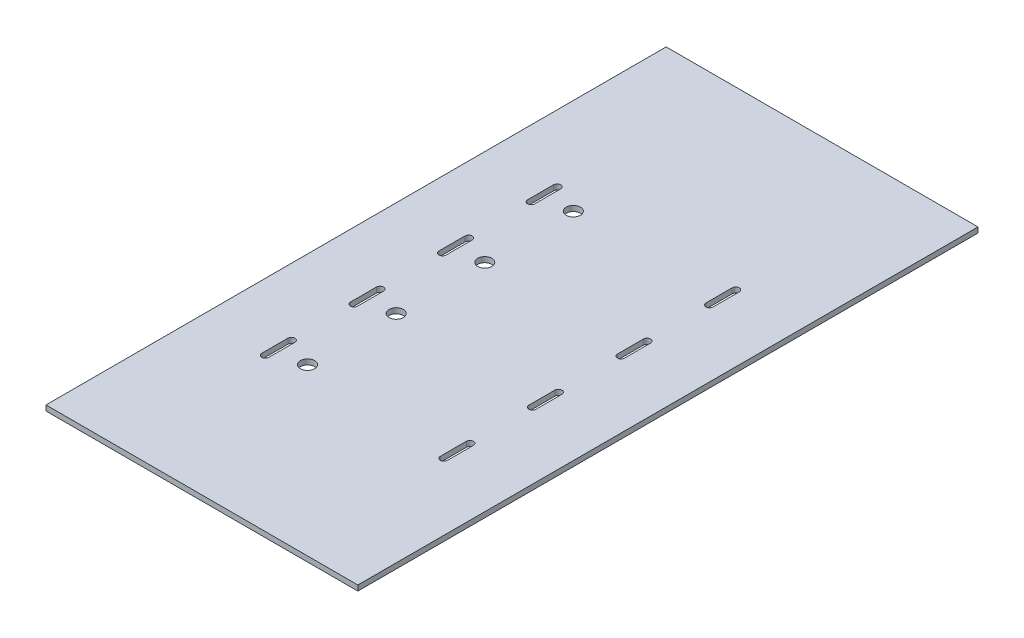
from build123d import *

# Parameters (mm, degrees)
SKETCH1_W                 = 176
SKETCH1_H                 = 350
BOSS_EXTRUDE1_DEPTH       = 3
F_4_0MM_DOWEL_SLOT1_DEPTH = 3
F_8_0MM_DOWEL_HOLE1_D     = 8
CUT_EXTRUDE1_DEPTH        = 0.5


# Read off the part's stored shape, not the designer's step: Ø4.0mm Dowel Slot1
with BuildPart() as part:
    # Sketch1 → Boss-Extrude1 (new body)
    with BuildSketch(Plane(origin=(0, 0, 0), x_dir=(1, 0, 0), z_dir=(0, 1, 0))):
        with Locations((88, 175)):
            Rectangle(SKETCH1_W, SKETCH1_H)
    extrude(amount=BOSS_EXTRUDE1_DEPTH)

    # Ø4.0mm Dowel Slot1 outline → Ø4.0mm Dowel Slot1 (cut)
    with BuildSketch(Plane(origin=(0, 0, 0), x_dir=(1, 0, 0), z_dir=(0, 1, 0))):
        with BuildLine():
            ThreePointArc((39.625, 250.85), (37.625, 252.85), (35.625, 250.85))
            Line((35.625, 250.85), (35.625, 236.15))
            ThreePointArc((35.625, 236.15), (37.625, 234.15), (39.625, 236.15))
            Line((39.625, 236.15), (39.625, 250.85))
        make_face()
        with BuildLine():
            Line((39.625, 186.15), (39.625, 200.85))
            ThreePointArc((39.625, 200.85), (37.625, 202.85), (35.625, 200.85))
            Line((35.625, 200.85), (35.625, 186.15))
            ThreePointArc((35.625, 186.15), (37.625, 184.15), (39.625, 186.15))
        make_face()
        with BuildLine():
            Line((39.625, 136.15), (39.625, 150.85))
            ThreePointArc((39.625, 150.85), (37.625, 152.85), (35.625, 150.85))
            Line((35.625, 150.85), (35.625, 136.15))
            ThreePointArc((35.625, 136.15), (37.625, 134.15), (39.625, 136.15))
        make_face()
        with BuildLine():
            Line((39.625, 86.15), (39.625, 100.85))
            ThreePointArc((39.625, 100.85), (37.625, 102.85), (35.625, 100.85))
            Line((35.625, 100.85), (35.625, 86.15))
            ThreePointArc((35.625, 86.15), (37.625, 84.15), (39.625, 86.15))
        make_face()
        with BuildLine():
            ThreePointArc((140.375, 250.85), (138.375, 252.85), (136.375, 250.85))
            Line((136.375, 250.85), (136.375, 236.15))
            ThreePointArc((136.375, 236.15), (138.375, 234.15), (140.375, 236.15))
            Line((140.375, 236.15), (140.375, 250.85))
        make_face()
        with BuildLine():
            Line((140.375, 186.15), (140.375, 200.85))
            ThreePointArc((140.375, 200.85), (138.375, 202.85), (136.375, 200.85))
            Line((136.375, 200.85), (136.375, 186.15))
            ThreePointArc((136.375, 186.15), (138.375, 184.15), (140.375, 186.15))
        make_face()
        with BuildLine():
            Line((140.375, 136.15), (140.375, 150.85))
            ThreePointArc((140.375, 150.85), (138.375, 152.85), (136.375, 150.85))
            Line((136.375, 150.85), (136.375, 136.15))
            ThreePointArc((136.375, 136.15), (138.375, 134.15), (140.375, 136.15))
        make_face()
        with BuildLine():
            Line((140.375, 86.15), (140.375, 100.85))
            ThreePointArc((140.375, 100.85), (138.375, 102.85), (136.375, 100.85))
            Line((136.375, 100.85), (136.375, 86.15))
            ThreePointArc((136.375, 86.15), (138.375, 84.15), (140.375, 86.15))
        make_face()
    extrude(amount=F_4_0MM_DOWEL_SLOT1_DEPTH, mode=Mode.SUBTRACT)

    # Ø8.0mm Dowel Hole1 (through all)
    with Locations(Plane(origin=(0, 3, 0), x_dir=(1, 0, 0), z_dir=(0, 1, 0))):
        with Locations((54.125, 93.5), (54.125, 143.5), (54.125, 193.5), (54.125, 243.5)):
            Hole(F_8_0MM_DOWEL_HOLE1_D / 2)

    # Sketch14 → Cut-Extrude1 (cut)
    # profile 1 of 13: a face of its own
    with BuildSketch(Plane.XZ):
        with BuildLine():
            add(Edge.make_bspline(
                [(140.85382816, -299.8668019), (140.92258671, -299.78523615), (141.58308592, -299.01837544), (142.32160419, -298.16266478)],
                knots=[0, 0, 0, 0, 1, 1, 1, 1], degree=3))
            Line((142.32160419, -298.16266478), (143.66436456, -296.60682777))
            Line((143.66436456, -296.60682777), (150.40594808, -296.60640175))
            Line((150.40594808, -296.60640175), (157.14753146, -296.6059758))
            Line((157.14753146, -296.6059758), (157.71891472, -297.93057096))
            add(Edge.make_bspline(
                [(157.71891472, -297.93057096), (158.03317566, -298.65910646), (158.29459409, -299.27160898), (158.29984451, -299.29168743)],
                knots=[0, 0, 0, 0, 1, 1, 1, 1], degree=3))
            add(Edge.make_bspline(
                [(158.29984451, -299.29168743), (158.30933056, -299.32796227), (158.26469534, -299.32822344), (151.27505338, -299.33284813)],
                knots=[0, 0, 0, 0, 1, 1, 1, 1], degree=3))
            Line((151.27505338, -299.33284813), (144.24071628, -299.33750236))
            Line((144.24071628, -299.33750236), (143.66198099, -300.00425236))
            Line((143.66198099, -300.00425236), (143.08324563, -300.67100236))
            Line((143.08324563, -300.67100236), (143.08252337, -302.03228403))
            Line((143.08252337, -302.03228403), (143.08180104, -303.39356528))
            Line((143.08180104, -303.39356528), (143.66942451, -304.07396717))
            Line((143.66942451, -304.07396717), (144.25703125, -304.75436906))
            Line((144.25703125, -304.75436906), (149.82469265, -304.75460797))
            Line((149.82469265, -304.75460797), (155.39235279, -304.75484688))
            Line((155.39235279, -304.75484688), (156.85797856, -306.45200717))
            Line((156.85797856, -306.45200717), (158.32360433, -308.14916739))
            Line((158.32360433, -308.14916739), (158.32360433, -310.17946335))
            Line((158.32360433, -310.17946335), (158.32360433, -312.20975917))
            Line((158.32360433, -312.20975917), (156.8568475, -313.90893231))
            Line((156.8568475, -313.90893231), (155.39009046, -315.60810538))
            Line((155.39009046, -315.60810538), (148.64782521, -315.60345017))
            Line((148.64782521, -315.60345017), (141.90555772, -315.59879482))
            Line((141.90555772, -315.59879482), (141.32644646, -314.25760497))
            add(Edge.make_bspline(
                [(141.32644646, -314.25760497), (141.00793442, -313.5199505), (140.74733331, -312.90945754), (140.74733331, -312.90095387)],
                knots=[0, 0, 0, 0, 1, 1, 1, 1], degree=3))
            add(Edge.make_bspline(
                [(140.74733331, -312.90095387), (140.74733331, -312.89245027), (143.91231226, -312.88517524), (147.78062055, -312.88478709)],
                knots=[0, 0, 0, 0, 1, 1, 1, 1], degree=3))
            Line((147.78062055, -312.88478709), (154.81390646, -312.88408142))
            Line((154.81390646, -312.88408142), (155.39228314, -312.21340666))
            Line((155.39228314, -312.21340666), (155.9706601, -311.54273211))
            Line((155.9706601, -311.54273211), (155.97106015, -310.18138828))
            Line((155.97106015, -310.18138828), (155.9714602, -308.82004459))
            Line((155.9714602, -308.82004459), (155.38456571, -308.13946637))
            Line((155.38456571, -308.13946637), (154.79767129, -307.45888836))
            Line((154.79767129, -307.45888836), (149.23001465, -307.45888836))
            Line((149.23001465, -307.45888836), (143.66235878, -307.45888836))
            Line((143.66235878, -307.45888836), (142.19558473, -305.75966706))
            Line((142.19558473, -305.75966706), (140.7288125, -304.06044583))
            Line((140.7288125, -304.06044583), (140.7288125, -302.03777392))
            Line((140.7288125, -302.03777392), (140.7288125, -300.01510187))
            Line((140.7288125, -300.01510187), (140.85382816, -299.8668019))
        make_face()
    # profile 2 of 13: a face of its own
    with BuildSketch(Plane.XZ):
        with BuildLine():
            add(Edge.make_bspline(
                [(124.36064824, -299.29540268), (124.36537107, -299.27734114), (124.62679258, -298.66493872), (124.94158377, -297.93451035)],
                knots=[0, 0, 0, 0, 1, 1, 1, 1], degree=3))
            Line((124.94158377, -297.93451035), (125.5139331, -296.60645922))
            Line((125.5139331, -296.60645922), (130.49617246, -296.60607023))
            Line((130.49617246, -296.60607023), (135.47841371, -296.60568131))
            Line((135.47841371, -296.60568131), (136.94596378, -298.30496589))
            Line((136.94596378, -298.30496589), (138.41349908, -300.00425236))
            Line((138.41349908, -300.00425236), (138.41368423, -304.0712672))
            Line((138.41368423, -304.0712672), (138.41386945, -308.13828162))
            Line((138.41386945, -308.13828162), (136.94781213, -309.83587654))
            Line((136.94781213, -309.83587654), (135.48175488, -311.53347153))
            Line((135.48175488, -311.53347153), (130.79037224, -311.53347153))
            Line((130.79037224, -311.53347153), (126.09898953, -311.53347153))
            Line((126.09898953, -311.53347153), (124.63510662, -309.83803275))
            Line((124.63510662, -309.83803275), (123.17122364, -308.14259397))
            Line((123.17122364, -308.14259397), (123.17122364, -307.12566113))
            Line((123.17122364, -307.12566113), (123.17122364, -306.10872815))
            Line((123.17122364, -306.10872815), (124.63508065, -304.4131416))
            Line((124.63508065, -304.4131416), (126.0987747, -302.71755484))
            Line((126.0987747, -302.71755484), (130.49676326, -302.71755484))
            Line((130.49676326, -302.71755484), (134.89475, -302.71755484))
            Line((134.89475, -302.71755484), (134.89475, -304.06957565))
            Line((134.89475, -304.06957565), (134.89475, -305.42159653))
            Line((134.89475, -305.42159653), (130.7947968, -305.42159653))
            Line((130.7947968, -305.42159653), (126.69484367, -305.42159653))
            Line((126.69484367, -305.42159653), (126.10902599, -306.10021188))
            Line((126.10902599, -306.10021188), (125.52320831, -306.77882723))
            Line((125.52320831, -306.77882723), (125.52320831, -307.12532702))
            Line((125.52320831, -307.12532702), (125.52320831, -307.47182681))
            Line((125.52320831, -307.47182681), (126.10836295, -308.15062836))
            Line((126.10836295, -308.15062836), (126.6935157, -308.82942984))
            Line((126.6935157, -308.82942984), (130.79023889, -308.82942984))
            Line((130.79023889, -308.82942984), (134.88696383, -308.82942984))
            Line((134.88696383, -308.82942984), (135.47415575, -308.14878918))
            Line((135.47415575, -308.14878918), (136.06134578, -307.46814859))
            Line((136.06134578, -307.46814859), (136.0608828, -304.06957565))
            Line((136.0608828, -304.06957565), (136.06041975, -300.67100236))
            Line((136.06041975, -300.67100236), (135.48220862, -300.00043708))
            Line((135.48220862, -300.00043708), (134.9039956, -299.3298718))
            Line((134.9039956, -299.3298718), (129.62802882, -299.32905686))
            add(Edge.make_bspline(
                [(129.62802882, -299.32905686), (124.58644682, -299.32827902), (124.35244165, -299.32678256), (124.36064824, -299.29540268)],
                knots=[0, 0, 0, 0, 1, 1, 1, 1], degree=3))
        make_face()
    # profile 3 of 13: a face of its own
    with BuildSketch(Plane.XZ):
        with BuildLine():
            add(Edge.make_bspline(
                [(105.5947898, -299.30509089), (105.5947898, -299.29235782), (105.85446488, -298.67978131), (106.17203605, -297.94380964)],
                knots=[0, 0, 0, 0, 1, 1, 1, 1], degree=3))
            Line((106.17203605, -297.94380964), (106.74943413, -296.60567949))
            Line((106.74943413, -296.60567949), (112.31661141, -296.60567949))
            Line((112.31661141, -296.60567949), (117.88378869, -296.60567949))
            Line((117.88378869, -296.60567949), (119.35117209, -298.30496589))
            Line((119.35117209, -298.30496589), (120.81870739, -300.00425236))
            Line((120.81870739, -300.00425236), (120.81889261, -304.0712672))
            Line((120.81889261, -304.0712672), (120.81907783, -308.13828162))
            Line((120.81907783, -308.13828162), (119.35302051, -309.83587654))
            Line((119.35302051, -309.83587654), (117.88696319, -311.53347153))
            Line((117.88696319, -311.53347153), (112.31746709, -311.53347153))
            Line((112.31746709, -311.53347153), (106.74797281, -311.53347153))
            Line((106.74797281, -311.53347153), (106.45430097, -310.85283087))
            add(Edge.make_bspline(
                [(106.45430097, -310.85283087), (106.29278262, -310.4784785), (106.03087769, -309.87215278), (105.87229115, -309.50544028)],
                knots=[0, 0, 0, 0, 1, 1, 1, 1], degree=3))
            Line((105.87229115, -309.50544028), (105.58395513, -308.83869028))
            Line((105.58395513, -308.83869028), (111.44202252, -308.82942984))
            Line((111.44202252, -308.82942984), (117.30008984, -308.8201694))
            Line((117.30008984, -308.8201694), (117.88342385, -308.14415903))
            Line((117.88342385, -308.14415903), (118.46675786, -307.46814859))
            Line((118.46675786, -307.46814859), (118.46627633, -304.06957565))
            Line((118.46627633, -304.06957565), (118.4657948, -300.67100236))
            Line((118.4657948, -300.67100236), (117.88758367, -300.00043708))
            Line((117.88758367, -300.00043708), (117.30937065, -299.3298718))
            Line((117.30937065, -299.3298718), (111.45215712, -299.32905686))
            add(Edge.make_bspline(
                [(111.45215712, -299.32905686), (106.77925266, -299.32840866), (105.59491209, -299.32356172), (105.5947898, -299.30509089)],
                knots=[0, 0, 0, 0, 1, 1, 1, 1], degree=3))
        make_face()
    # profile 4 of 13: a face of its own
    with BuildSketch(Plane.XZ):
        Polygon((100.30807354, -296.60567949), (101.77536062, -298.30478074), (103.24264581, -300.00386715), (103.24264581, -305.7686699), (103.24264581, -311.53347153), (102.06657294, -311.53347153), (100.8905, -311.53347153), (100.8905, -306.10687126), (100.8905, -300.68027022), (100.3054232, -300.00421533), (99.72034451, -299.32816044), (95.61539072, -299.3328314), (91.51043504, -299.33750236), (90.93214243, -300.00425236), (90.35384975, -300.67100236), (90.35299778, -306.10223712), (90.35214581, -311.53347153), (89.17607294, -311.53347153), (88, -311.53347153), (88, -305.76673594), (88, -300), (89.46562577, -298.30283971), (90.93125154, -296.60567949), (95.61966345, -296.60567949), align=None)
    # profile 5 of 13: a face of its own
    with BuildSketch(Plane.XZ):
        Polygon((85.66620091, -296.60567949), (85.666375, -302.37198073), (85.666375, -308.13828162), (84.20027883, -309.83592043), (82.73418259, -311.53355945), (78.92090599, -311.52888541), (75.10762939, -311.52421109), (74.52775135, -310.18145065), (73.94787149, -308.83869028), (78.04763016, -308.82942984), (82.14738701, -308.8201694), (82.73072109, -308.14415903), (83.3140551, -307.46814859), (83.3140551, -302.03691418), (83.3140551, -296.60567949), (84.49012797, -296.60567949), align=None)
    # profile 6 of 13: a face of its own
    with BuildSketch(Plane.XZ):
        with BuildLine():
            add(Edge.make_bspline(
                [(54.13928647, -299.86680554), (54.20804509, -299.7852435), (54.8685443, -299.01836249), (55.6070625, -298.16262964)],
                knots=[0, 0, 0, 0, 1, 1, 1, 1], degree=3))
            Line((55.6070625, -298.16262964), (56.94982294, -296.60675))
            Line((56.94982294, -296.60675), (64.27944272, -296.60621289))
            Line((64.27944272, -296.60621289), (71.6090625, -296.60567578))
            Line((71.6090625, -296.60567578), (71.6090625, -306.10686734))
            Line((71.6090625, -306.10686734), (71.6090625, -315.60805484))
            Line((71.6090625, -315.60805484), (64.45539066, -315.60755665))
            Line((64.45539066, -315.60755665), (57.30171875, -315.60705839))
            Line((57.30171875, -315.60705839), (55.95895831, -314.05121417))
            add(Edge.make_bspline(
                [(55.95895831, -314.05121417), (55.22044011, -313.1954998), (54.5599409, -312.4286043), (54.49118228, -312.34700208)],
                knots=[0, 0, 0, 0, 1, 1, 1, 1], degree=3))
            Line((54.49118228, -312.34700208), (54.36616669, -312.19863428))
            Line((54.36616669, -312.19863428), (54.36616669, -310.17570995))
            Line((54.36616669, -310.17570995), (54.36616669, -308.15278562))
            Line((54.36616669, -308.15278562), (55.15330206, -307.24163475))
            add(Edge.make_bspline(
                [(55.15330206, -307.24163475), (55.58622658, -306.74050188), (55.9404375, -306.32155062), (55.9404375, -306.31063244)],
                knots=[0, 0, 0, 0, 1, 1, 1, 1], degree=3))
            add(Edge.make_bspline(
                [(55.9404375, -306.31063244), (55.9404375, -306.29971405), (55.50705, -305.78906391), (54.97735419, -305.17585432)],
                knots=[0, 0, 0, 0, 1, 1, 1, 1], degree=3))
            Line((54.97735419, -305.17585432), (54.01427081, -304.06092771))
            Line((54.01427081, -304.06092771), (54.01427081, -302.03801584))
            Line((54.01427081, -302.03801584), (54.01427081, -300.01510376))
            Line((54.01427081, -300.01510376), (54.13928647, -299.86680554))
        make_face()
        Polygon((57.53969663, -299.32824199), (56.95305666, -300.00736386), (56.36641669, -300.6864858), (56.36641669, -302.0415444), (56.36641669, -303.39660307), (56.95305666, -304.0757248), (57.53969663, -304.75484653), (62.81490041, -304.75484653), (68.09010419, -304.75484653), (68.09010419, -306.11612778), (68.09010419, -307.47740903), (62.9907983, -307.47740903), (57.89149059, -307.47740903), (57.30490249, -308.15455032), (56.7183125, -308.83169161), (56.7183125, -310.18145065), (56.7183125, -311.53120976), (57.30490249, -312.20835105), (57.89149059, -312.88549234), (63.57420455, -312.88549234), (69.25691669, -312.88549234), (69.25691669, -306.10686734), (69.25691669, -299.32824199), (63.39830666, -299.32824199), align=None, mode=Mode.SUBTRACT)
    # profile 7 of 13: a face of its own
    with BuildSketch(Plane.XZ):
        with BuildLine():
            add(Edge.make_bspline(
                [(36.47504169, -313.63588835), (36.47504169, -313.40051279), (36.61892445, -313.13701578), (36.81400444, -313.01513962)],
                knots=[0, 0, 0, 0, 1, 1, 1, 1], degree=3))
            Line((36.81400444, -313.01513962), (36.9177618, -312.95031675))
            Line((36.9177618, -312.95031675), (36.9186508, -312.20859976))
            Line((36.9186508, -312.20859976), (36.9195398, -311.46688284))
            Line((36.9195398, -311.46688284), (34.34557554, -307.75897255))
            Line((34.34557554, -307.75897255), (31.77160939, -304.05106226))
            Line((31.77160939, -304.05106226), (34.35946613, -300.32007332))
            Line((34.35946613, -300.32007332), (36.94732105, -296.58908662))
            Line((36.94732105, -296.58908662), (42.13315443, -296.58908662))
            Line((42.13315443, -296.58908662), (47.31898774, -296.58908662))
            Line((47.31898774, -296.58908662), (49.90682782, -300.32004742))
            Line((49.90682782, -300.32004742), (52.49466797, -304.05105134))
            Line((52.49466797, -304.05105134), (49.90682782, -307.78202747))
            Line((49.90682782, -307.78202747), (47.31898956, -311.51300374))
            Line((47.31898956, -311.51300374), (42.41559897, -311.51397793))
            Line((42.41559897, -311.51397793), (37.51220831, -311.51495212))
            Line((37.51220831, -311.51495212), (37.51220831, -312.2244584))
            Line((37.51220831, -312.2244584), (37.51220831, -312.93396468))
            Line((37.51220831, -312.93396468), (37.62622627, -313.00696362))
            add(Edge.make_bspline(
                [(37.62622627, -313.00696362), (37.83257619, -313.13907735), (37.97522919, -313.3960239), (37.97522919, -313.63558756)],
                knots=[0, 0, 0, 0, 1, 1, 1, 1], degree=3))
            add(Edge.make_bspline(
                [(37.97522919, -313.63558756), (37.97522919, -314.12407045), (37.48259726, -314.4928056), (37.0183651, -314.3517997)],
                knots=[0, 0, 0, 0, 1, 1, 1, 1], degree=3))
            add(Edge.make_bspline(
                [(37.0183651, -314.3517997), (36.70211637, -314.25574171), (36.47504169, -313.95653749), (36.47504169, -313.63588835)],
                knots=[0, 0, 0, 0, 1, 1, 1, 1], degree=3))
        make_face()
        with BuildLine():
            add(Edge.make_bspline(
                [(50.22886254, -304.04120192), (50.22288398, -304.02511144), (47.01417183, -299.39579297), (46.5096329, -298.67534184)],
                knots=[0, 0, 0, 0, 1, 1, 1, 1], degree=3))
            Line((46.5096329, -298.67534184), (46.34423445, -298.43916233))
            Line((46.34423445, -298.43916233), (42.12897053, -298.4438314))
            Line((42.12897053, -298.4438314), (37.9137085, -298.44850236))
            Line((37.9137085, -298.44850236), (35.97211402, -301.24514824))
            add(Edge.make_bspline(
                [(35.97211402, -301.24514824), (34.90423609, -302.78330381), (34.03052689, -304.04596164), (34.03053802, -304.05105484)],
                knots=[0, 0, 0, 0, 1, 1, 1, 1], degree=3))
            add(Edge.make_bspline(
                [(34.03053802, -304.05105484), (34.03054726, -304.05614804), (34.90427312, -305.31880587), (35.97214734, -306.85696109)],
                knots=[0, 0, 0, 0, 1, 1, 1, 1], degree=3))
            Line((35.97214734, -306.85696109), (37.91374, -309.6536069))
            Line((37.91374, -309.6536069), (42.13315625, -309.6536069))
            Line((42.13315625, -309.6536069), (46.3525725, -309.6536069))
            Line((46.3525725, -309.6536069), (48.2942689, -306.85696109))
            add(Edge.make_bspline(
                [(48.2942689, -306.85696109), (49.36220234, -305.31880587), (50.23276861, -304.05171417), (50.22886254, -304.04120192)],
                knots=[0, 0, 0, 0, 1, 1, 1, 1], degree=3))
        make_face(mode=Mode.SUBTRACT)
    # profile 8 of 13: a face of its own
    with BuildSketch(Plane.XZ):
        with BuildLine():
            add(Edge.make_bspline(
                [(45.328, -302.30147785), (45.4451443, -302.29770107), (45.56599272, -302.29857005), (45.59655206, -302.30340922)],
                knots=[0, 0, 0, 0, 1, 1, 1, 1], degree=3))
            add(Edge.make_bspline(
                [(45.59655206, -302.30340922), (46.00304178, -302.36777758), (46.31681062, -302.52078302), (46.59362114, -302.78961571)],
                knots=[0, 0, 0, 0, 1, 1, 1, 1], degree=3))
            add(Edge.make_bspline(
                [(46.59362114, -302.78961571), (46.832188, -303.02130836), (46.99304142, -303.29984592), (47.07286809, -303.61949441)],
                knots=[0, 0, 0, 0, 1, 1, 1, 1], degree=3))
            add(Edge.make_bspline(
                [(47.07286809, -303.61949441), (47.10473874, -303.74711351), (47.11357687, -303.8367847), (47.11357687, -304.03253403)],
                knots=[0, 0, 0, 0, 1, 1, 1, 1], degree=3))
            add(Edge.make_bspline(
                [(47.11357687, -304.03253403), (47.11357687, -304.40403285), (47.03371877, -304.68043835), (46.8376998, -304.98740739)],
                knots=[0, 0, 0, 0, 1, 1, 1, 1], degree=3))
            add(Edge.make_bspline(
                [(46.8376998, -304.98740739), (46.74240453, -305.13664123), (46.51250731, -305.36976559), (46.36160698, -305.47018297)],
                knots=[0, 0, 0, 0, 1, 1, 1, 1], degree=3))
            add(Edge.make_bspline(
                [(46.36160698, -305.47018297), (46.0506996, -305.67707938), (45.76478236, -305.76254784), (45.3835625, -305.76254784)],
                knots=[0, 0, 0, 0, 1, 1, 1, 1], degree=3))
            add(Edge.make_bspline(
                [(45.3835625, -305.76254784), (45.01206424, -305.76254784), (44.73565748, -305.68269023), (44.42868949, -305.48667077)],
                knots=[0, 0, 0, 0, 1, 1, 1, 1], degree=3))
            add(Edge.make_bspline(
                [(44.42868949, -305.48667077), (44.279456, -305.39137529), (44.04633059, -305.16147863), (43.94591433, -305.01057921)],
                knots=[0, 0, 0, 0, 1, 1, 1, 1], degree=3))
            add(Edge.make_bspline(
                [(43.94591433, -305.01057921), (43.73901806, -304.69967092), (43.65354813, -304.41375389), (43.65354813, -304.03253403)],
                knots=[0, 0, 0, 0, 1, 1, 1, 1], degree=3))
            add(Edge.make_bspline(
                [(43.65354813, -304.03253403), (43.65354813, -303.8367847), (43.66238626, -303.74711351), (43.69425691, -303.61949441)],
                knots=[0, 0, 0, 0, 1, 1, 1, 1], degree=3))
            add(Edge.make_bspline(
                [(43.69425691, -303.61949441), (43.77408358, -303.29984592), (43.934937, -303.02130836), (44.17350386, -302.78961571)],
                knots=[0, 0, 0, 0, 1, 1, 1, 1], degree=3))
            add(Edge.make_bspline(
                [(44.17350386, -302.78961571), (44.49972423, -302.47279704), (44.86998538, -302.31624484), (45.328, -302.30147785)],
                knots=[0, 0, 0, 0, 1, 1, 1, 1], degree=3))
        make_face()
    # profile 9 of 13: a face of its own
    with BuildSketch(Plane.XZ):
        with BuildLine():
            add(Edge.make_bspline(
                [(38.84570831, -302.30147785), (38.96285261, -302.29770107), (39.08370103, -302.29857005), (39.11426044, -302.30340922)],
                knots=[0, 0, 0, 0, 1, 1, 1, 1], degree=3))
            add(Edge.make_bspline(
                [(39.11426044, -302.30340922), (39.52075009, -302.36777758), (39.83451893, -302.52078302), (40.11132945, -302.78961571)],
                knots=[0, 0, 0, 0, 1, 1, 1, 1], degree=3))
            add(Edge.make_bspline(
                [(40.11132945, -302.78961571), (40.34989631, -303.02130836), (40.5107498, -303.29984592), (40.5905764, -303.61949441)],
                knots=[0, 0, 0, 0, 1, 1, 1, 1], degree=3))
            add(Edge.make_bspline(
                [(40.5905764, -303.61949441), (40.62244705, -303.74711351), (40.63128518, -303.8367847), (40.63128518, -304.03253403)],
                knots=[0, 0, 0, 0, 1, 1, 1, 1], degree=3))
            add(Edge.make_bspline(
                [(40.63128518, -304.03253403), (40.63128518, -304.40403285), (40.55142708, -304.68043835), (40.35540811, -304.98740739)],
                knots=[0, 0, 0, 0, 1, 1, 1, 1], degree=3))
            add(Edge.make_bspline(
                [(40.35540811, -304.98740739), (40.26011291, -305.13664123), (40.03021562, -305.36976559), (39.87931529, -305.47018297)],
                knots=[0, 0, 0, 0, 1, 1, 1, 1], degree=3))
            add(Edge.make_bspline(
                [(39.87931529, -305.47018297), (39.56840791, -305.67707938), (39.28249074, -305.76254784), (38.90127081, -305.76254784)],
                knots=[0, 0, 0, 0, 1, 1, 1, 1], degree=3))
            add(Edge.make_bspline(
                [(38.90127081, -305.76254784), (38.51946015, -305.76254784), (38.23454678, -305.67723086), (37.92160583, -305.4691882)],
                knots=[0, 0, 0, 0, 1, 1, 1, 1], degree=3))
            add(Edge.make_bspline(
                [(37.92160583, -305.4691882), (37.77444854, -305.3713576), (37.5400618, -305.13248225), (37.44422389, -304.98266272)],
                knots=[0, 0, 0, 0, 1, 1, 1, 1], degree=3))
            add(Edge.make_bspline(
                [(37.44422389, -304.98266272), (37.25146461, -304.68133197), (37.17125644, -304.40215041), (37.17125644, -304.03253403)],
                knots=[0, 0, 0, 0, 1, 1, 1, 1], degree=3))
            add(Edge.make_bspline(
                [(37.17125644, -304.03253403), (37.17125644, -303.8367847), (37.18009464, -303.74711351), (37.21196529, -303.61949441)],
                knots=[0, 0, 0, 0, 1, 1, 1, 1], degree=3))
            add(Edge.make_bspline(
                [(37.21196529, -303.61949441), (37.29179189, -303.29984592), (37.45264531, -303.02130836), (37.69121217, -302.78961571)],
                knots=[0, 0, 0, 0, 1, 1, 1, 1], degree=3))
            add(Edge.make_bspline(
                [(37.69121217, -302.78961571), (38.01743261, -302.47279704), (38.38769369, -302.31624484), (38.84570831, -302.30147785)],
                knots=[0, 0, 0, 0, 1, 1, 1, 1], degree=3))
        make_face()
    # profile 10 of 13: a face of its own
    with BuildSketch(Plane.XZ):
        with BuildLine():
            add(Edge.make_bspline(
                [(18.51508583, -299.30509096), (18.5311138, -299.2648285), (19.63487583, -296.70994617), (19.65928259, -296.65661177)],
                knots=[0, 0, 0, 0, 1, 1, 1, 1], degree=3))
            Line((19.65928259, -296.65661177), (19.68259105, -296.60567949))
            Line((19.68259105, -296.60567949), (22.31838897, -296.60567949))
            Line((22.31838897, -296.60567949), (24.95418696, -296.60567949))
            Line((24.95418696, -296.60567949), (26.41778098, -298.30051725))
            Line((26.41778098, -298.30051725), (27.881375, -299.99535683))
            Line((27.881375, -299.99535683), (27.881375, -304.41239316))
            Line((27.881375, -304.41239316), (27.881375, -308.82942984))
            Line((27.881375, -308.82942984), (29.05744794, -308.82942984))
            Line((29.05744794, -308.82942984), (30.23352081, -308.82942984))
            Line((30.23352081, -308.82942984), (30.23352081, -310.18145065))
            Line((30.23352081, -310.18145065), (30.23352081, -311.53347153))
            Line((30.23352081, -311.53347153), (29.05756645, -311.53347153))
            Line((29.05756645, -311.53347153), (27.88161391, -311.53347153))
            Line((27.88161391, -311.53347153), (27.87686336, -312.8960083))
            Line((27.87686336, -312.8960083), (27.87211456, -314.25854507))
            Line((27.87211456, -314.25854507), (26.7145625, -314.92924034))
            Line((26.7145625, -314.92924034), (25.55701044, -315.59993568))
            Line((25.55701044, -315.59993568), (25.54775, -313.57133379))
            Line((25.54775, -313.57133379), (25.53848956, -311.5427319))
            Line((25.53848956, -311.5427319), (22.02416147, -311.53805394))
            Line((22.02416147, -311.53805394), (18.50983331, -311.53337577))
            Line((18.50983331, -311.53337577), (18.50983331, -310.18145065))
            Line((18.50983331, -310.18145065), (18.50983331, -308.8295256))
            Line((18.50983331, -308.8295256), (22.02416147, -308.82484743))
            Line((22.02416147, -308.82484743), (25.53848956, -308.8201694))
            Line((25.53848956, -308.8201694), (25.54316052, -304.75389859))
            Line((25.54316052, -304.75389859), (25.54783337, -300.68762666))
            Line((25.54783337, -300.68762666), (24.96160269, -300.00793436))
            Line((24.96160269, -300.00793436), (24.37537201, -299.32824199))
            Line((24.37537201, -299.32824199), (21.44062187, -299.32824199))
            add(Edge.make_bspline(
                [(21.44062187, -299.32824199), (19.10025342, -299.32824199), (18.50773681, -299.32355248), (18.51508583, -299.30509096)],
                knots=[0, 0, 0, 0, 1, 1, 1, 1], degree=3))
        make_face()
    # profile 11 of 13: a face of its own
    with BuildSketch(Plane.XZ):
        with BuildLine():
            add(Edge.make_bspline(
                [(40.01777522, -316.33036734), (40.02042927, -316.33036734), (40.09289943, -316.40103521), (40.1788231, -316.48740716)],
                knots=[0, 0, 0, 0, 1, 1, 1, 1], degree=3))
            Line((40.1788231, -316.48740716), (40.33504637, -316.64444698))
            Line((40.33504637, -316.64444698), (40.28027837, -316.70239312))
            add(Edge.make_bspline(
                [(40.28027837, -316.70239312), (40.25015611, -316.73426335), (40.14633386, -316.82691087), (40.0495625, -316.90827621)],
                knots=[0, 0, 0, 0, 1, 1, 1, 1], degree=3))
            add(Edge.make_bspline(
                [(40.0495625, -316.90827621), (39.26923904, -317.56437326), (38.23823053, -317.9415537), (37.22513544, -317.9415537)],
                knots=[0, 0, 0, 0, 1, 1, 1, 1], degree=3))
            add(Edge.make_bspline(
                [(37.22513544, -317.9415537), (36.21229585, -317.9415537), (35.18353952, -317.56531966), (34.40070831, -316.90861291)],
                knots=[0, 0, 0, 0, 1, 1, 1, 1], degree=3))
            add(Edge.make_bspline(
                [(34.40070831, -316.90861291), (34.30393702, -316.82743279), (34.20859359, -316.74297394), (34.18883553, -316.72092688)],
                knots=[0, 0, 0, 0, 1, 1, 1, 1], degree=3))
            Line((34.18883553, -316.72092688), (34.15290887, -316.68084117))
            Line((34.15290887, -316.68084117), (34.30881168, -316.5241251))
            add(Edge.make_bspline(
                [(34.30881168, -316.5241251), (34.39455755, -316.43793116), (34.46906506, -316.36770499), (34.47438233, -316.36806647)],
                knots=[0, 0, 0, 0, 1, 1, 1, 1], degree=3))
            add(Edge.make_bspline(
                [(34.47438233, -316.36806647), (34.47970156, -316.36842767), (34.57025174, -316.44309177), (34.67560566, -316.53398558)],
                knots=[0, 0, 0, 0, 1, 1, 1, 1], degree=3))
            add(Edge.make_bspline(
                [(34.67560566, -316.53398558), (35.58678992, -317.32010455), (36.80120648, -317.63772311), (37.99375, -317.40181401)],
                knots=[0, 0, 0, 0, 1, 1, 1, 1], degree=3))
            add(Edge.make_bspline(
                [(37.99375, -317.40181401), (38.67031792, -317.26797492), (39.26087502, -316.97750565), (39.80055913, -316.51312481)],
                knots=[0, 0, 0, 0, 1, 1, 1, 1], degree=3))
            add(Edge.make_bspline(
                [(39.80055913, -316.51312481), (39.91737562, -316.41260817), (40.01512299, -316.33036734), (40.01777522, -316.33036734)],
                knots=[0, 0, 0, 0, 1, 1, 1, 1], degree=3))
        make_face()
    # profile 12 of 13: a face of its own
    with BuildSketch(Plane.XZ):
        with BuildLine():
            add(Edge.make_bspline(
                [(37.7715, -316.25860019), (38.26704526, -316.15220061), (38.66837507, -315.95357673), (39.04200693, -315.62981014)],
                knots=[0, 0, 0, 0, 1, 1, 1, 1], degree=3))
            Line((39.04200693, -315.62981014), (39.19200531, -315.4998319))
            Line((39.19200531, -315.4998319), (39.35365148, -315.66223015))
            Line((39.35365148, -315.66223015), (39.51529576, -315.82462854))
            Line((39.51529576, -315.82462854), (39.39812185, -315.93093964))
            add(Edge.make_bspline(
                [(39.39812185, -315.93093964), (38.87938293, -316.4015859), (38.26499503, -316.67712438), (37.55851044, -316.75596237)],
                knots=[0, 0, 0, 0, 1, 1, 1, 1], degree=3))
            add(Edge.make_bspline(
                [(37.55851044, -316.75596237), (36.72878819, -316.84855284), (35.85968331, -316.58415276), (35.18979213, -316.03534786)],
                knots=[0, 0, 0, 0, 1, 1, 1, 1], degree=3))
            add(Edge.make_bspline(
                [(35.18979213, -316.03534786), (35.11741458, -315.97605324), (35.04197369, -315.90944453), (35.02214339, -315.88732845)],
                knots=[0, 0, 0, 0, 1, 1, 1, 1], degree=3))
            Line((35.02214339, -315.88732845), (34.98608709, -315.84711709))
            Line((34.98608709, -315.84711709), (35.14623855, -315.68696654))
            Line((35.14623855, -315.68696654), (35.30638819, -315.52681578))
            Line((35.30638819, -315.52681578), (35.41538519, -315.62161748))
            add(Edge.make_bspline(
                [(35.41538519, -315.62161748), (35.68902303, -315.85962112), (36.04449528, -316.06549924), (36.36391669, -316.1709765)],
                knots=[0, 0, 0, 0, 1, 1, 1, 1], degree=3))
            add(Edge.make_bspline(
                [(36.36391669, -316.1709765), (36.66595815, -316.27071467), (36.86538304, -316.30035505), (37.23439581, -316.30035505)],
                knots=[0, 0, 0, 0, 1, 1, 1, 1], degree=3))
            add(Edge.make_bspline(
                [(37.23439581, -316.30035505), (37.52007043, -316.30035505), (37.60936124, -316.29341364), (37.7715, -316.25860019)],
                knots=[0, 0, 0, 0, 1, 1, 1, 1], degree=3))
        make_face()
    # profile 13 of 13: a face of its own
    with BuildSketch(Plane.XZ):
        with BuildLine():
            add(Edge.make_bspline(
                [(38.2933115, -314.60792984), (38.29705461, -314.60792984), (38.37293447, -314.68108712), (38.46193443, -314.77050148)],
                knots=[0, 0, 0, 0, 1, 1, 1, 1], degree=3))
            Line((38.46193443, -314.77050148), (38.6237528, -314.93307305))
            Line((38.6237528, -314.93307305), (38.51711172, -315.0232775))
            add(Edge.make_bspline(
                [(38.51711172, -315.0232775), (38.29163724, -315.21399579), (38.01401367, -315.3578054), (37.71974907, -315.43631096)],
                knots=[0, 0, 0, 0, 1, 1, 1, 1], degree=3))
            add(Edge.make_bspline(
                [(37.71974907, -315.43631096), (37.56191643, -315.47841862), (37.50384436, -315.48426824), (37.24365625, -315.48426824)],
                knots=[0, 0, 0, 0, 1, 1, 1, 1], degree=3))
            add(Edge.make_bspline(
                [(37.24365625, -315.48426824), (36.98346821, -315.48426824), (36.92539614, -315.47841862), (36.76756343, -315.43631096)],
                knots=[0, 0, 0, 0, 1, 1, 1, 1], degree=3))
            add(Edge.make_bspline(
                [(36.76756343, -315.43631096), (36.55663523, -315.38003838), (36.31880736, -315.27262534), (36.14517082, -315.15521105)],
                knots=[0, 0, 0, 0, 1, 1, 1, 1], degree=3))
            add(Edge.make_bspline(
                [(36.14517082, -315.15521105), (36.01154488, -315.06485211), (35.90089581, -314.96965211), (35.90089581, -314.94504046)],
                knots=[0, 0, 0, 0, 1, 1, 1, 1], degree=3))
            add(Edge.make_bspline(
                [(35.90089581, -314.94504046), (35.90089581, -314.93662128), (35.97118981, -314.86095219), (36.05710424, -314.77688667)],
                knots=[0, 0, 0, 0, 1, 1, 1, 1], degree=3))
            Line((36.05710424, -314.77688667), (36.21331449, -314.62404034))
            Line((36.21331449, -314.62404034), (36.31176571, -314.70416724))
            add(Edge.make_bspline(
                [(36.31176571, -314.70416724), (36.85790067, -315.14864687), (37.68281854, -315.13931811), (38.20145372, -314.68279736)],
                knots=[0, 0, 0, 0, 1, 1, 1, 1], degree=3))
            add(Edge.make_bspline(
                [(38.20145372, -314.68279736), (38.24823178, -314.64162035), (38.28956846, -314.60792984), (38.2933115, -314.60792984)],
                knots=[0, 0, 0, 0, 1, 1, 1, 1], degree=3))
        make_face()
    extrude(amount=-CUT_EXTRUDE1_DEPTH, mode=Mode.SUBTRACT)


solid = part.part
